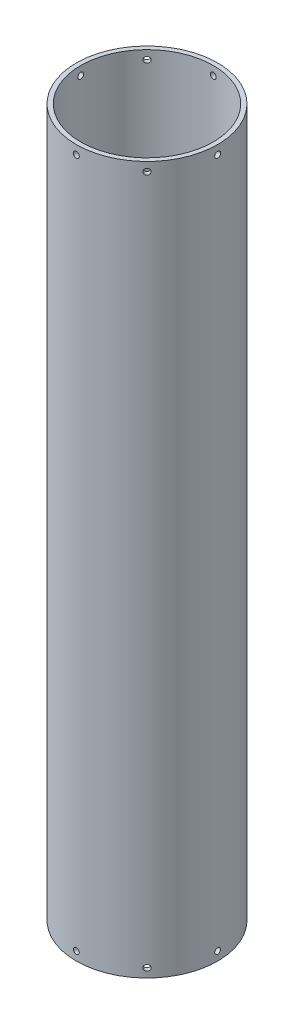
from build123d import *

# Parameters (mm, degrees)
SKETCH1_R                 = 76.2
SKETCH1_R_2               = 71.4375
INNER_OUTERDIAMETER_DEPTH = 762
SKETCH2_R                 = 3.175
TOP_BOTTOMBOLTHOLES_DEPTH = 770.582276303
CIRPATTERN1_COUNT         = 8


with BuildPart() as part:
    # Sketch1 → Inner&OuterDiameter (new body)
    with BuildSketch(Plane(origin=(0, 0, 0), x_dir=(1, 0, 0), z_dir=(0, 1, 0))):
        Circle(SKETCH1_R)
        Circle(SKETCH1_R_2, mode=Mode.SUBTRACT)
    extrude(amount=INNER_OUTERDIAMETER_DEPTH)

    # Sketch2 → Top&BottomBoltHoles (cut, through all)
    with BuildSketch(Plane.XY):
        with Locations((0, 752.475)):
            Circle(SKETCH2_R)
        with Locations((0, 9.525)):
            Circle(SKETCH2_R)
    top_bottomboltholes = extrude(amount=-TOP_BOTTOMBOLTHOLES_DEPTH, mode=Mode.SUBTRACT)

    # CirPattern1: Top&BottomBoltHoles ×8 about axis
    cirpattern1_axis = Axis((0, 762, 0), (0, -1, 0))
    for i in range(1, CIRPATTERN1_COUNT):
        add(top_bottomboltholes.rotate(cirpattern1_axis, i * 360 / CIRPATTERN1_COUNT), mode=Mode.SUBTRACT)


solid = part.part
